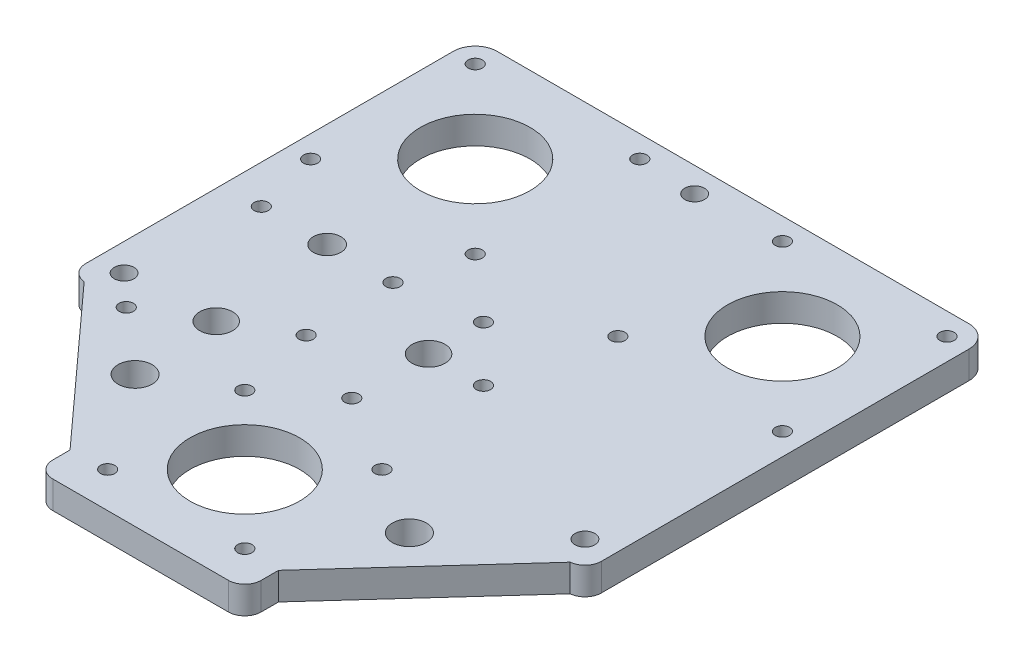
from build123d import *

# Parameters (mm, degrees)
SKETCH1_W                                       = 94
SKETCH1_H                                       = 108
BOSS_EXTRUDE1_DEPTH                             = 5
FILLET1_R                                       = 4
SKETCH22_W                                      = 28
SKETCH22_H                                      = 5
CUT_EXTRUDE3_DEPTH                              = 34
CSK_FOR_M3_FLAT_HEAD_MACHINE_SCREW1_D           = 3.6
CSK_FOR_M3_FLAT_HEAD_MACHINE_SCREW1_CSINK_D     = 6.3
CSK_FOR_M3_FLAT_HEAD_MACHINE_SCREW1_CSINK_ANGLE = 90
FILLET4_R                                       = 3
CHAMFER3_DEPTH                                  = 5
CSK_FOR_M2_FLAT_HEAD_MACHINE_SCREW2_D           = 2.6
CSK_FOR_M2_FLAT_HEAD_MACHINE_SCREW2_CSINK_D     = 4.4
CSK_FOR_M2_FLAT_HEAD_MACHINE_SCREW2_CSINK_ANGLE = 90
CUT_EXTRUDE4_DEPTH                              = 72.763500472
CUT_EXTRUDE4_DEPTH_BACK                         = 72.763500472
SKETCH25_R                                      = 1.3
SKETCH25_R_2                                    = 3
CHAMFER1_SIZE                                   = 0.9
SKETCH26_R                                      = 2.5
SKETCH26_R_2                                    = 1.3
CUT_EXTRUDE8_DEPTH                              = 10
CHAMFER2_SIZE                                   = 0.9
SKETCH27_R                                      = 10
CUT_EXTRUDE9_DEPTH                              = 10
SKETCH29_R                                      = 3.1
CUT_EXTRUDE11_DEPTH                             = 72.763500472
SKETCH30_R                                      = 3
SKETCH30_R_2                                    = 1.3
CUT_EXTRUDE12_DEPTH                             = 72.763500472
CHAMFER4_SIZE                                   = 0.9


with BuildPart() as part:
    # Sketch1 → Boss-Extrude1 (new body)
    with BuildSketch(Plane(origin=(0, 0, 0), x_dir=(1, 0, 0), z_dir=(0, 1, 0))):
        Rectangle(SKETCH1_W, SKETCH1_H)
    extrude(amount=BOSS_EXTRUDE1_DEPTH)

    # Fillet1
    fillet1_edges = [part.edges().sort_by_distance(p)[0] for p in [
        (47, 2.5, 54),
        (-47, 2.5, 54),
        (-47, 2.5, -54),
        (47, 2.5, -54),
    ]]
    fillet(fillet1_edges, radius=FILLET1_R)

    # Sketch22 → Cut-Extrude3 (cut)
    with BuildSketch(Plane.XY.offset(54)):
        with Locations((-33, 2.5)):
            Rectangle(SKETCH22_W, SKETCH22_H)
        with Locations((33, 2.5)):
            Rectangle(SKETCH22_W, SKETCH22_H)
    extrude(amount=-CUT_EXTRUDE3_DEPTH, mode=Mode.SUBTRACT)

    # CSK for M3 Flat Head Machine Screw1 (through all)
    with Locations(Plane(origin=(0, 0, 0), x_dir=(-1, 0, 0), z_dir=(0, -1, 0))):
        with Locations((-42, -49), (2.5, 49.5), (42, -49), (-42, -15), (42, -15)):
            CounterSinkHole(CSK_FOR_M3_FLAT_HEAD_MACHINE_SCREW1_D / 2, CSK_FOR_M3_FLAT_HEAD_MACHINE_SCREW1_CSINK_D / 2, counter_sink_angle=CSK_FOR_M3_FLAT_HEAD_MACHINE_SCREW1_CSINK_ANGLE)

    # Fillet4
    fillet4_edges = [part.edges().sort_by_distance(p)[0] for p in [
        (-47, 2.5, 20),
        (-19, 2.5, 54),
        (47, 2.5, 20),
        (19, 2.5, 54),
    ]]
    fillet(fillet4_edges, radius=FILLET4_R)

    # Chamfer3: read off the stored shape, not the designer's step
    # Chamfer3 outline → Chamfer3 (add)
    with BuildSketch(Plane(origin=(0, 0, 0), x_dir=(1, 0, 0), z_dir=(0, 1, 0))):
        with BuildLine():
            Line((19, -20), (19, -47.854497241))
            Line((19, -47.854497241), (44.290322581, -19.985919088))
            ThreePointArc((44.290322581, -19.985919088), (44.145331925, -19.996477704), (44, -20))
            Line((44, -20), (19, -20))
        make_face()
        with BuildLine():
            ThreePointArc((-44, -20), (-44.145331925, -19.996477704), (-44.290322581, -19.985919088))
            Line((-44.290322581, -19.985919088), (-19, -47.854497241))
            Line((-19, -47.854497241), (-19, -20))
            Line((-19, -20), (-44, -20))
        make_face()
    extrude(amount=CHAMFER3_DEPTH)

    # CSK for M2 Flat Head Machine Screw2 (through all)
    with Locations(Plane(origin=(0, 0, 0), x_dir=(-1, 0, 0), z_dir=(0, -1, 0))):
        with Locations((12.5, -47.5), (-12.5, -47.5), (12.5, -22.5), (-12.5, -22.5), (-43, 50), (-13, 50), (-43, 20), (-13, 20), (43, 50), (43, 20), (13, 50), (13, 20)):
            CounterSinkHole(CSK_FOR_M2_FLAT_HEAD_MACHINE_SCREW2_D / 2, CSK_FOR_M2_FLAT_HEAD_MACHINE_SCREW2_CSINK_D / 2, counter_sink_angle=CSK_FOR_M2_FLAT_HEAD_MACHINE_SCREW2_CSINK_ANGLE)

    # Sketch25 → Cut-Extrude4 (cut, two sides: drawn at the far end of the back side and taken through both)
    with BuildSketch(Plane(origin=(0, 0, 0), x_dir=(1, 0, 0), z_dir=(0, 1, 0)).offset(-CUT_EXTRUDE4_DEPTH_BACK)):
        with Locations(Location((-1.5, 10, 0), (0, 0, 270))):
            Circle(SKETCH25_R)
        with Locations(Location((8.5, 0, 0), (0, 0, 270))):
            Circle(SKETCH25_R)
        with Locations(Location((-1.5, -14, 0), (0, 0, 270))):
            Circle(SKETCH25_R)
        with Locations(Location((-1.5, 0, 0), (0, 0, 270))):
            Circle(SKETCH25_R_2)
    extrude(amount=CUT_EXTRUDE4_DEPTH + CUT_EXTRUDE4_DEPTH_BACK, mode=Mode.SUBTRACT)

    # Chamfer1
    chamfer1_edges = [part.edges().sort_by_distance(p)[0] for p in [
        (-1.5, 0, -11.3),
        (8.5, 0, -1.3),
        (-1.5, 0, 12.7),
    ]]
    chamfer(chamfer1_edges, length=CHAMFER1_SIZE)

    # Sketch26 → Cut-Extrude8 (cut)
    with BuildSketch(Plane(origin=(0, 0, 0), x_dir=(1, 0, 0), z_dir=(0, 1, 0))):
        with Locations(Location((-28, 8.0125, 0), (0, 0, 270))):
            Circle(SKETCH26_R)
        with Locations(Location((-40, 8.0125, 0), (0, 0, 270))):
            Circle(SKETCH26_R_2)
        with Locations(Location((-16, 8.0125, 0), (0, 0, 90))):
            Circle(SKETCH26_R_2)
    extrude(amount=CUT_EXTRUDE8_DEPTH, mode=Mode.SUBTRACT)

    # Chamfer2
    chamfer2_edges = [part.edges().sort_by_distance(p)[0] for p in [
        (-16, 0, -6.7125),
        (-40, 0, -9.3125),
    ]]
    chamfer(chamfer2_edges, length=CHAMFER2_SIZE)

    # Sketch27 → Cut-Extrude9 (cut)
    with BuildSketch(Plane(origin=(0, 5, 0), x_dir=(1, 0, 0), z_dir=(0, 1, 0))):
        with Locations(Location((-28, 35, 0), (0, 0, 270))):
            Circle(SKETCH27_R)
        with Locations(Location((28, 35, 0), (0, 0, 270))):
            Circle(SKETCH27_R)
        with Locations(Location((0, -35, 0), (0, 0, 270))):
            Circle(SKETCH27_R)
    extrude(amount=-CUT_EXTRUDE9_DEPTH, mode=Mode.SUBTRACT)

    # Sketch29 → Cut-Extrude11 (cut, through all)
    with BuildSketch(Plane(origin=(0, 5, 0), x_dir=(1, 0, 0), z_dir=(0, 1, 0))):
        with Locations(Location((-25, -30, 0), (0, 0, 270))):
            Circle(SKETCH29_R)
        with Locations(Location((25, -30, 0), (0, 0, 270))):
            Circle(SKETCH29_R)
    extrude(amount=-CUT_EXTRUDE11_DEPTH, mode=Mode.SUBTRACT)

    # Sketch30 → Cut-Extrude12 (cut, through all)
    with BuildSketch(Plane(origin=(0, 5, 0), x_dir=(1, 0, 0), z_dir=(0, 1, 0))):
        with Locations(Location((-26, -14.21, 0), (0, 0, 270))):
            Circle(SKETCH30_R)
        with Locations(Location((-15.607695155, -8.21, 0), (0, 0, 270))):
            Circle(SKETCH30_R_2)
        with Locations(Location((-36.392304845, -20.21, 0), (0, 0, 270))):
            Circle(SKETCH30_R_2)
    extrude(amount=-CUT_EXTRUDE12_DEPTH, mode=Mode.SUBTRACT)

    # Chamfer4
    chamfer4_edges = [part.edges().sort_by_distance(p)[0] for p in [
        (-36.392304845, 0, 18.91),
        (-15.607695155, 0, 6.91),
    ]]
    chamfer(chamfer4_edges, length=CHAMFER4_SIZE)


solid = part.part
